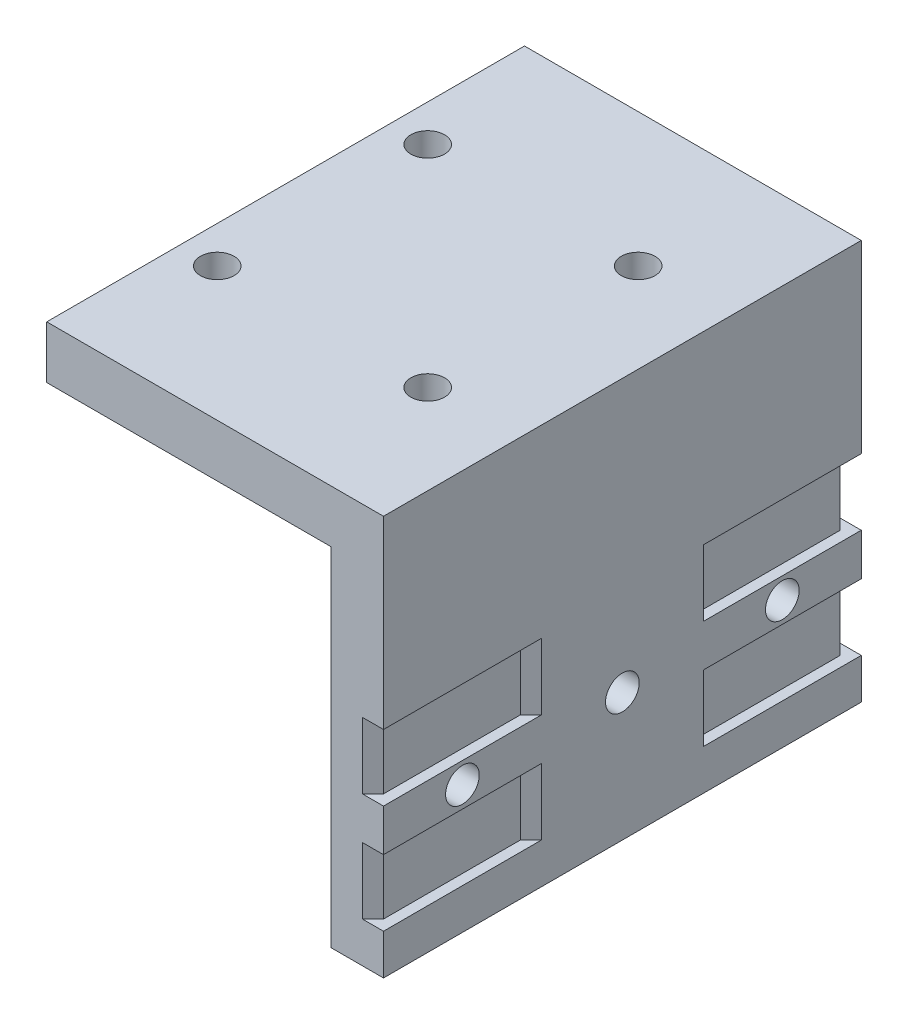
from build123d import *

# Parameters (mm, degrees)
MAIN_BLOCK_DEPTH                 = 5
BELT_START                       = -1
BELT_CLAMP_CUTOUT_SKETCH_W       = 15
BELT_CLAMP_CUTOUT_SKETCH_H       = 6.3
BELT_CLAMP_CUTOUT_DEPTH          = 1
BELT_CLAMP_SCREW_HOLES_D         = 3.2
BELT_CLAMP_SCREW_NUT_TRAPS_DEPTH = 2.3
BELT_GUIDE_CHAMFERS_SIZE         = 1
RAIL_MOUNT_BLOCK_SKETCH_W        = 45.4
RAIL_MOUNT_BLOCK_SKETCH_H        = 5
CARRIAGE_MOUNTING_BLOCK_DEPTH    = 27
CARRIAGE_MOUNTING_HOLES_D        = 3.2


with BuildPart() as part:
    # Main Block Sketch → Main Block (new body)
    with BuildSketch(Plane(origin=(30.899718474, 0, 0), x_dir=(0, 0, -1), z_dir=(1, 0, 0))):
        Polygon((-55.037241551, 38.898583536), (-9.637241551, 38.898583536), (-9.637241551, 33.898583536), (-9.637241551, 0.898583536), (-55.037241551, 0.898583536), (-55.037241551, 33.898583536), align=None)
    extrude(amount=MAIN_BLOCK_DEPTH)

    # Belt Clamp Cutout Sketch → Belt Clamp Cutout (cut)
    with BuildSketch(Plane(origin=(35.899718474, 0, 0), x_dir=(0, 0, -1), z_dir=(1, 0, 0)).offset(BELT_START)):
        with Locations((-47.537241551, 7.898583536)):
            Rectangle(BELT_CLAMP_CUTOUT_SKETCH_W, BELT_CLAMP_CUTOUT_SKETCH_H)
        with Locations((-17.137241551, 7.898583536)):
            Rectangle(BELT_CLAMP_CUTOUT_SKETCH_W, BELT_CLAMP_CUTOUT_SKETCH_H)
        with Locations((-17.137241551, 18.198583536)):
            Rectangle(BELT_CLAMP_CUTOUT_SKETCH_W, BELT_CLAMP_CUTOUT_SKETCH_H)
        with Locations((-47.537241551, 18.198583536)):
            Rectangle(BELT_CLAMP_CUTOUT_SKETCH_W, BELT_CLAMP_CUTOUT_SKETCH_H)
    extrude(amount=BELT_CLAMP_CUTOUT_DEPTH, mode=Mode.SUBTRACT)

    # Belt Clamp Screw Holes (through all)
    with Locations(Plane(origin=(35.899718474, 0, 0), x_dir=(0, 0, -1), z_dir=(1, 0, 0))):
        with Locations((-47.537241551, 13.048583536), (-17.137241551, 13.048583536), (-32.337241551, 13.048583536)):
            Hole(BELT_CLAMP_SCREW_HOLES_D / 2)

    # Nut Trap Sketch → Belt Clamp Screw Nut Traps (cut)
    with BuildSketch(Plane(origin=(30.899718474, 0, 0), x_dir=(0, 0, -1), z_dir=(1, 0, 0))):
        Polygon((-45.978395824, 15.748583536), (-49.096087278, 15.748583536), (-50.654933005, 13.048583536), (-49.096087278, 10.348583536), (-45.978395824, 10.348583536), (-44.419550097, 13.048583536), align=None)
        Polygon((-30.778395824, 15.748583536), (-33.896087278, 15.748583536), (-35.454933005, 13.048583536), (-33.896087278, 10.348583536), (-30.778395824, 10.348583536), (-29.219550097, 13.048583536), align=None)
        Polygon((-15.578395824, 15.748583536), (-18.696087278, 15.748583536), (-20.254933005, 13.048583536), (-18.696087278, 10.348583536), (-15.578395824, 10.348583536), (-14.019550097, 13.048583536), align=None)
    extrude(amount=BELT_CLAMP_SCREW_NUT_TRAPS_DEPTH, mode=Mode.SUBTRACT)

    # Belt Guide Chamfers
    belt_guide_chamfers_edges = [part.edges().sort_by_distance(p)[0] for p in [
        (34.899718474, 7.898583536, 40.037241551),
        (34.899718474, 18.198583536, 40.037241551),
        (34.899718474, 7.898583536, 24.637241551),
        (34.899718474, 18.198583536, 24.637241551),
    ]]
    chamfer(belt_guide_chamfers_edges, length=BELT_GUIDE_CHAMFERS_SIZE - 0.0001)  # a hair under: the kernel refuses the full size
    belt_guide_chamfers_2_edges = [part.edges().sort_by_distance(p)[0] for p in [
        (34.899718474, 18.198583536, 55.037241551),
        (34.899718474, 7.898583536, 55.037241551),
        (34.899718474, 7.898583536, 9.637241551),
        (34.899718474, 18.198583536, 9.637241551),
    ]]
    chamfer(belt_guide_chamfers_2_edges, length=BELT_GUIDE_CHAMFERS_SIZE)

    # Rail Mount Block Sketch → Carriage Mounting Block (add)
    with BuildSketch(Plane(origin=(30.899718474, 0, 0), x_dir=(0, 0, -1), z_dir=(1, 0, 0))):
        with Locations((-32.337241551, 36.398583536)):
            Rectangle(RAIL_MOUNT_BLOCK_SKETCH_W, RAIL_MOUNT_BLOCK_SKETCH_H)
    extrude(amount=-CARRIAGE_MOUNTING_BLOCK_DEPTH)

    # Carriage Mounting Holes (through all)
    with Locations(Plane(origin=(0, 38.898583536, 0), x_dir=(1, 0, 0), z_dir=(0, 1, 0))):
        with Locations((7.399718474, -42.337241551), (27.399718474, -42.337241551), (7.399718474, -22.337241551), (27.399718474, -22.337241551)):
            Hole(CARRIAGE_MOUNTING_HOLES_D / 2)


solid = part.part
